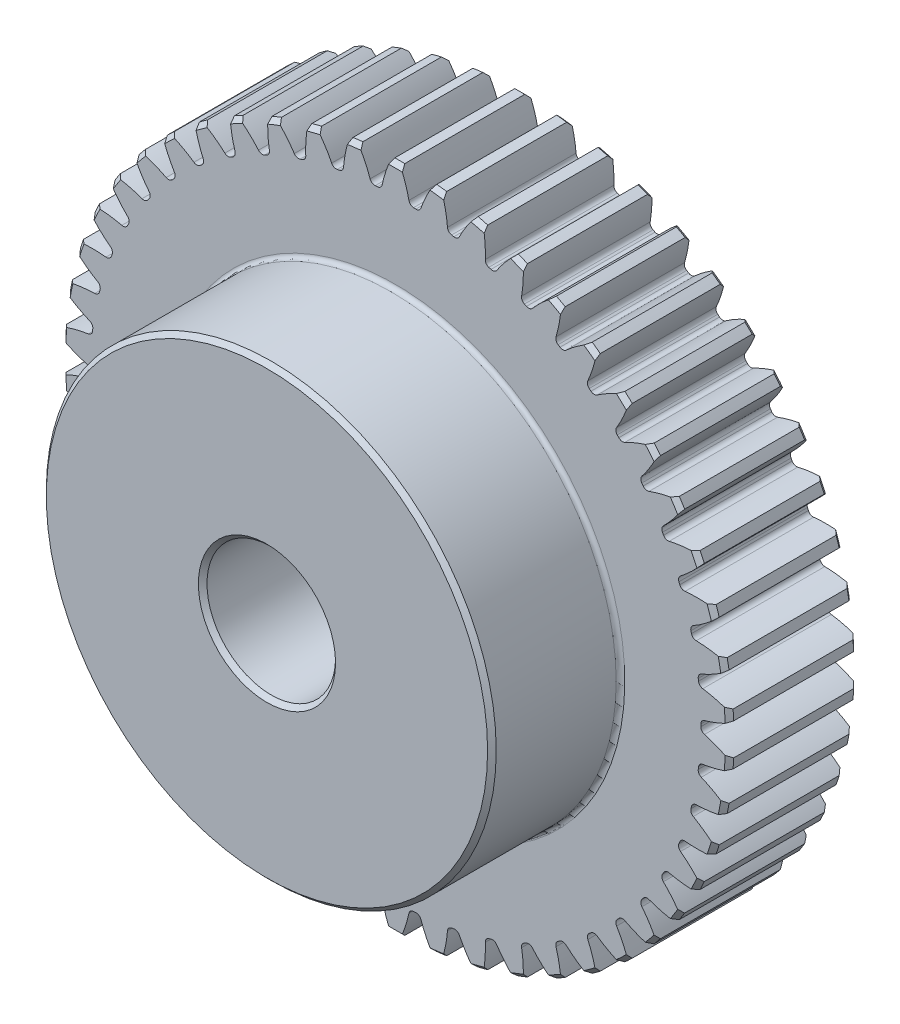
from build123d import *

# Parameters (mm, degrees)
BOSS_EXTRUDE1_DEPTH      = 10
BOSS_EXTRUDE1_DEPTH_BACK = 10
SKETCH3_R                = 26
SKETCH5_W                = 10
SKETCH5_H                = 8.5
SKETCH5_W_2              = 20
SKETCH5_H_2              = 5
FILLET2_R                = 0.335505036
CHAMFER1_SIZE            = 0.335505036
CUT_EXTRUDE1_DEPTH       = 39.105117767
FILLET1_R                = 0.392699082
CIRPATTERN1_COUNT        = 50
FILLET1_OF_CIRPATTERN1_R = 0.392699082


with BuildPart() as part:
    # Sketch3 → Boss-Extrude1 (new, two sides: drawn at the far end of the back side and taken through both)
    with BuildSketch(Plane.XY.offset(-BOSS_EXTRUDE1_DEPTH_BACK)):
        Circle(SKETCH3_R)
    extrude(amount=BOSS_EXTRUDE1_DEPTH + BOSS_EXTRUDE1_DEPTH_BACK)

    # Sketch5 → Cut-Revolve1 (revolve, cut)
    with BuildSketch(Plane(origin=(0, 0, 0), x_dir=(0, 0, -1), z_dir=(1, 0, 0)), mode=Mode.PRIVATE) as cut_revolve1_sk:
        with Locations((-5, 21.75)):
            Rectangle(SKETCH5_W, SKETCH5_H)
        with Locations((0, 2.5)):
            Rectangle(SKETCH5_W_2, SKETCH5_H_2)
    revolve(cut_revolve1_sk.sketch.rotate(Axis((0, 0, 10), (0, 0, -1)), 180), axis=Axis((0, 0, 10), (0, 0, -1)), mode=Mode.SUBTRACT)

    # Fillet2
    fillet2_edges = [part.edges().sort_by_distance(p)[0] for p in [
        (0, 17.5, 0),
    ]]
    fillet(fillet2_edges, radius=FILLET2_R)

    # Chamfer1
    chamfer1_edges = [part.edges().sort_by_distance(p)[0] for p in [
        (0, 5, 10),
        (0, 5, -10),
        (-26, 0, 0),
        (0, 17.5, 10),
        (-26, 0, -10),
    ]]
    chamfer(chamfer1_edges, length=CHAMFER1_SIZE)

    # Sketch4 → Cut-Extrude1 (cut, symmetric)
    with BuildSketch(Plane.XY):
        with BuildLine():
            Line((23.746753198, 0.392699082), (23.746753198, -0.392699082))
            ThreePointArc((23.746753198, -0.392699082), (24.885030259, -0.749772311), (25.970153797, -1.245436376))
            ThreePointArc((25.970153797, -1.245436376), (26, 0), (25.970153797, 1.245436376))
            ThreePointArc((25.970153797, 1.245436376), (24.885030259, 0.749772311), (23.746753198, 0.392699082))
        make_face()
    cut_extrude1 = extrude(amount=CUT_EXTRUDE1_DEPTH, both=True, mode=Mode.SUBTRACT)

    # Fillet1
    fillet1_edges = [part.edges().sort_by_distance(p)[0] for p in [
        (23.746753198, 0.392699082, -5),
        (23.746753198, -0.392699082, -5),
    ]]
    fillet(fillet1_edges, radius=FILLET1_R)

    # CirPattern1: Cut-Extrude1 ×50 about axis
    cirpattern1_axis = Axis((0, 0, 0), (0, 0, 1))
    for i in range(1, CIRPATTERN1_COUNT):
        add(cut_extrude1.rotate(cirpattern1_axis, i * 360 / CIRPATTERN1_COUNT), mode=Mode.SUBTRACT)

    # Fillet1 of CirPattern1
    fillet1_of_cirpattern1_edges = [part.edges().sort_by_distance(p)[0] for p in [
        (23.51028471, 3.365859897, -5),
        (23.608721202, 2.586654833, -5),
        (22.903044988, 6.285939091, -5),
        (23.098365569, 5.525215655, -5),
        (21.934610566, 9.106885271, -5),
        (22.223734913, 8.376640526, -5),
        (20.620254231, 11.78421043, -5),
        (20.998622682, 11.095960772, -5),
        (18.980704169, 14.27569155, -5),
        (19.442349627, 13.640291089, -5),
        (17.041817064, 16.542036487, -5),
        (17.579459104, 15.969505866, -5),
        (14.834170324, 18.547503627, -5),
        (15.43933001, 18.046871996, -5),
        (12.392579856, 20.260465555, -5),
        (13.055713458, 19.839628174, -5),
        (9.755551001, 21.653907838, -5),
        (10.466200506, 21.319501565, -5),
        (6.964671279, 22.705855059, -5),
        (7.71162932, 22.46315368, -5),
        (4.06395453, 23.399717382, -5),
        (4.835441133, 23.252548442, -5),
        (1.099146791, 23.724552184, -5),
        (1.88299515, 23.675236625, -5),
        (-1.88299515, 23.675236625, -5),
        (-1.099146791, 23.724552184, -5),
        (-4.835441133, 23.252548442, -5),
        (-4.06395453, 23.399717382, -5),
        (-7.71162932, 22.46315368, -5),
        (-6.964671279, 22.705855059, -5),
        (-10.466200506, 21.319501565, -5),
        (-9.755551001, 21.653907838, -5),
        (-13.055713458, 19.839628174, -5),
        (-12.392579856, 20.260465555, -5),
        (-15.43933001, 18.046871996, -5),
        (-14.834170324, 18.547503627, -5),
        (-17.579459104, 15.969505866, -5),
        (-17.041817064, 16.542036487, -5),
        (-19.442349627, 13.640291089, -5),
        (-18.980704169, 14.27569155, -5),
        (-20.998622682, 11.095960772, -5),
        (-20.620254231, 11.78421043, -5),
        (-22.223734913, 8.376640526, -5),
        (-21.934610566, 9.106885271, -5),
        (-23.098365569, 5.525215655, -5),
        (-22.903044988, 6.285939091, -5),
        (-23.608721202, 2.586654833, -5),
        (-23.51028471, 3.365859897, -5),
        (-23.746753198, -0.392699082, -5),
        (-23.746753198, 0.392699082, -5),
        (-23.51028471, -3.365859897, -5),
        (-23.608721202, -2.586654833, -5),
        (-22.903044988, -6.285939091, -5),
        (-23.098365569, -5.525215655, -5),
        (-21.934610566, -9.106885271, -5),
        (-22.223734913, -8.376640526, -5),
        (-20.620254231, -11.78421043, -5),
        (-20.998622682, -11.095960772, -5),
        (-18.980704169, -14.27569155, -5),
        (-19.442349627, -13.640291089, -5),
        (-17.041817064, -16.542036487, -5),
        (-17.579459104, -15.969505866, -5),
        (-14.834170324, -18.547503627, -5),
        (-15.43933001, -18.046871996, -5),
        (-12.392579856, -20.260465555, -5),
        (-13.055713458, -19.839628174, -5),
        (-9.755551001, -21.653907838, -5),
        (-10.466200506, -21.319501565, -5),
        (-6.964671279, -22.705855059, -5),
        (-7.71162932, -22.46315368, -5),
        (-4.06395453, -23.399717382, -5),
        (-4.835441133, -23.252548442, -5),
        (-1.099146791, -23.724552184, -5),
        (-1.88299515, -23.675236625, -5),
        (1.88299515, -23.675236625, -5),
        (1.099146791, -23.724552184, -5),
        (4.835441133, -23.252548442, -5),
        (4.06395453, -23.399717382, -5),
        (7.71162932, -22.46315368, -5),
        (6.964671279, -22.705855059, -5),
        (10.466200506, -21.319501565, -5),
        (9.755551001, -21.653907838, -5),
        (13.055713458, -19.839628174, -5),
        (12.392579856, -20.260465555, -5),
        (15.43933001, -18.046871996, -5),
        (14.834170324, -18.547503627, -5),
        (17.579459104, -15.969505866, -5),
        (17.041817064, -16.542036487, -5),
        (19.442349627, -13.640291089, -5),
        (18.980704169, -14.27569155, -5),
        (20.998622682, -11.095960772, -5),
        (20.620254231, -11.78421043, -5),
        (22.223734913, -8.376640526, -5),
        (21.934610566, -9.106885271, -5),
        (23.098365569, -5.525215655, -5),
        (22.903044988, -6.285939091, -5),
        (23.608721202, -2.586654833, -5),
        (23.51028471, -3.365859897, -5),
    ]]
    fillet(fillet1_of_cirpattern1_edges, radius=FILLET1_OF_CIRPATTERN1_R)


solid = part.part
